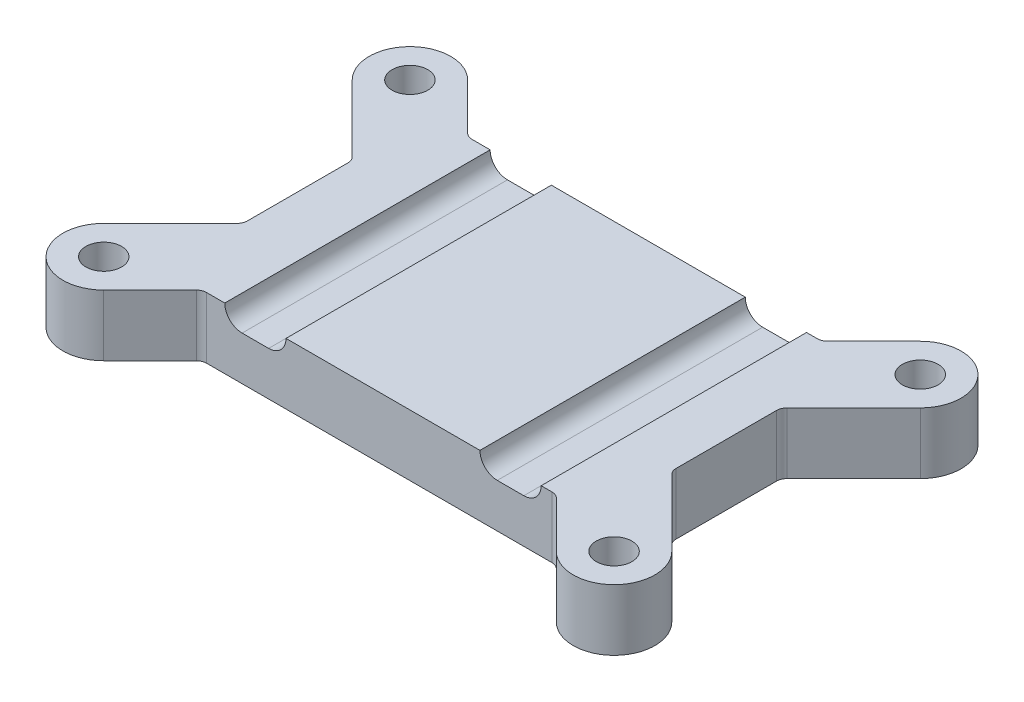
from build123d import *

# Parameters (mm, degrees)
SKETCH1_R                 = 1.75
BASE_DEPTH                = 6
WIRE_GROOVES_DEPTH        = 44.600458713
F_1MM_SIDE_EDGE_FILLETS_R = 1


with BuildPart() as part:
    # Sketch1 → Base (new body)
    with BuildSketch(Plane(origin=(0, 0, 0), x_dir=(1, 0, 0), z_dir=(0, 1, 0))):
        with BuildLine():
            Line((-17.343145751, 13), (17.343145751, 13))
            Line((17.343145751, 13), (22.171572875, 17.828427125))
            ThreePointArc((22.171572875, 17.828427125), (27.828427125, 17.828427125), (27.828427125, 12.171572875))
            Line((27.828427125, 12.171572875), (21, 5.343145751))
            Line((21, 5.343145751), (21, -5.343145751))
            Line((21, -5.343145751), (27.828427125, -12.171572875))
            ThreePointArc((27.828427125, -12.171572875), (27.828427125, -17.828427125), (22.171572875, -17.828427125))
            Line((22.171572875, -17.828427125), (17.343145751, -13))
            Line((17.343145751, -13), (-17.343145751, -13))
            Line((-17.343145751, -13), (-22.171572875, -17.828427125))
            ThreePointArc((-22.171572875, -17.828427125), (-27.828427125, -17.828427125), (-27.828427125, -12.171572875))
            Line((-27.828427125, -12.171572875), (-21, -5.343145751))
            Line((-21, -5.343145751), (-21, 5.343145751))
            Line((-21, 5.343145751), (-27.828427125, 12.171572875))
            ThreePointArc((-27.828427125, 12.171572875), (-27.828427125, 17.828427125), (-22.171572875, 17.828427125))
            Line((-22.171572875, 17.828427125), (-17.343145751, 13))
        make_face()
        with Locations((-25, 15)):
            Circle(SKETCH1_R, mode=Mode.SUBTRACT)
        with Locations((-25, -15)):
            Circle(SKETCH1_R, mode=Mode.SUBTRACT)
        with Locations((25, -15)):
            Circle(SKETCH1_R, mode=Mode.SUBTRACT)
        with Locations((25, 15)):
            Circle(SKETCH1_R, mode=Mode.SUBTRACT)
    extrude(amount=BASE_DEPTH)

    # Sketch2 → Wire Grooves (cut, through all)
    with BuildSketch(Plane.XY.offset(13)):
        with BuildLine():
            Line((-15.143145751, 6), (-9.143145751, 6))
            ThreePointArc((-9.143145751, 6), (-9.641064222, 4.797918472), (-10.843145751, 4.3))
            Line((-10.843145751, 4.3), (-13.443145751, 4.3))
            ThreePointArc((-13.443145751, 4.3), (-14.645227279, 4.797918472), (-15.143145751, 6))
        make_face()
        with BuildLine():
            Line((9.856854249, 6), (15.856854249, 6))
            ThreePointArc((15.856854249, 6), (15.358935778, 4.797918472), (14.156854249, 4.3))
            Line((14.156854249, 4.3), (11.556854249, 4.3))
            ThreePointArc((11.556854249, 4.3), (10.354772721, 4.797918472), (9.856854249, 6))
        make_face()
    extrude(amount=-WIRE_GROOVES_DEPTH, mode=Mode.SUBTRACT)

    # 1mm Side Edge Fillets
    f_1mm_side_edge_fillets_edges = [part.edges().sort_by_distance(p)[0] for p in [
        (-21, 3, 5.343145751),
        (-17.343145751, 3, -13),
        (17.343145751, 3, -13),
        (21, 3, -5.343145751),
        (21, 3, 5.343145751),
        (17.343145751, 3, 13),
        (-17.343145751, 3, 13),
        (-21, 3, -5.343145751),
    ]]
    fillet(f_1mm_side_edge_fillets_edges, radius=F_1MM_SIDE_EDGE_FILLETS_R)


solid = part.part
